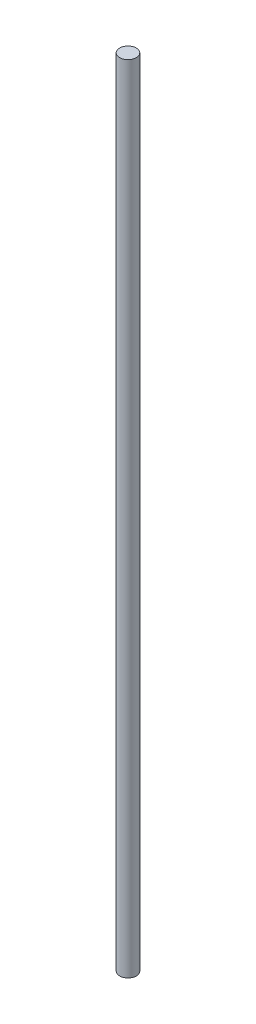
from build123d import *

# Parameters (mm, degrees)
SKETCH1_R           = 1.5
BOSS_EXTRUDE1_DEPTH = 143


with BuildPart() as part:
    # Sketch1 → Boss-Extrude1 (new body)
    with BuildSketch(Plane(origin=(0, 0, 0), x_dir=(1, 0, 0), z_dir=(0, 1, 0))):
        Circle(SKETCH1_R)
    extrude(amount=BOSS_EXTRUDE1_DEPTH)


solid = part.part
